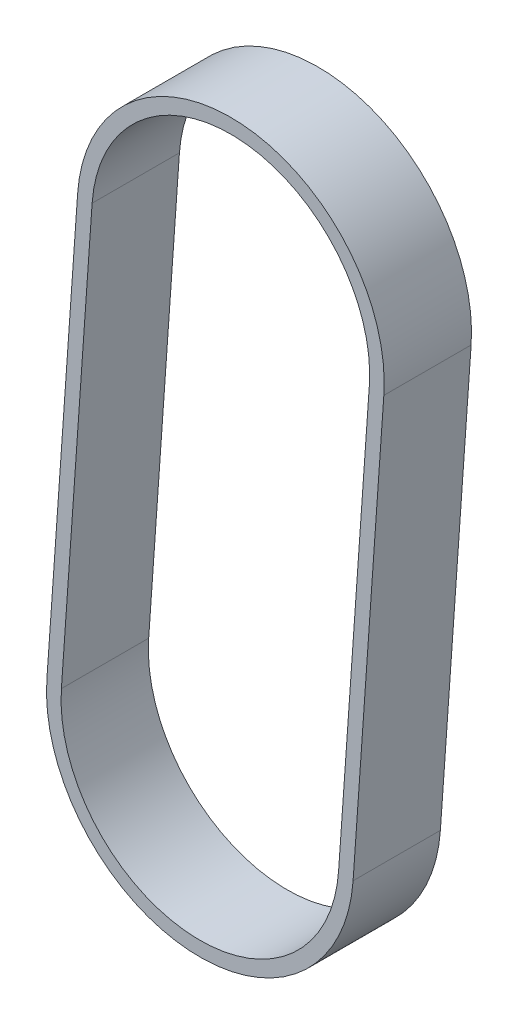
from build123d import *

# Parameters (mm, degrees)
EXTRUDE_THIN1_DEPTH = 9


with BuildPart() as part:
    # Sketch2 → Extrude-Thin1 (new body)
    with BuildSketch(Plane.XY):
        with BuildLine():
            Line((15.784715598, -1.113546137), (12.615790494, -46.033626126))
            ThreePointArc((12.615790494, -46.033626126), (-4.282471243, -60.704795589), (-18.953640706, -43.806533851))
            Line((-18.953640706, -43.806533851), (-15.784715598, 1.113546138))
            ThreePointArc((-15.784715598, 1.113546138), (1.113546137, 15.784715599), (15.784715598, -1.113546137))
        make_face()
        with BuildLine():
            Line((14.288434261, -1.007989702), (11.119509157, -45.928069691))
            ThreePointArc((11.119509157, -45.928069691), (-4.176914809, -59.208514252), (-17.457359369, -43.912090286))
            Line((-17.457359369, -43.912090286), (-14.288434261, 1.007989703))
            ThreePointArc((-14.288434261, 1.007989703), (1.007989702, 14.288434262), (14.288434261, -1.007989702))
        make_face(mode=Mode.SUBTRACT)
    extrude(amount=EXTRUDE_THIN1_DEPTH)


solid = part.part
